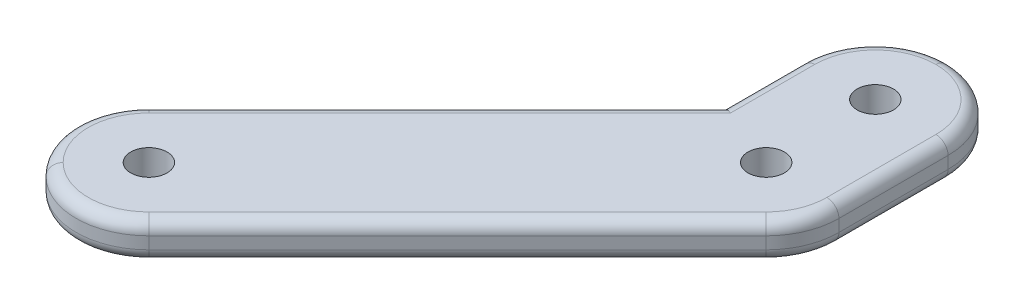
from build123d import *

# Parameters (mm, degrees)
SKETCH1_R           = 3.175
BOSS_EXTRUDE1_DEPTH = 6.35
FILLET2_R           = 12.7
FILLET3_R           = 2.116666667


with BuildPart() as part:
    # Sketch1 → Boss-Extrude1 (new body)
    with BuildSketch(Plane(origin=(0, 0, 0), x_dir=(1, 0, 0), z_dir=(0, 1, 0))):
        with BuildLine():
            Line((12.7, 31.205256121), (-12.7, 31.205256121))
            Line((-12.7, 31.205256121), (-12.7, 4.715768363))
            Line((-12.7, 4.715768363), (-71.842048969, -54.426280605))
            Line((-71.842048969, -54.426280605), (-53.881536726, -72.386792847))
            Line((-53.881536726, -72.386792847), (8.980256121, -9.525))
            ThreePointArc((8.980256121, -9.525), (11.733270063, -5.40482347), (12.7, -0.544743879))
            Line((12.7, -0.544743879), (12.7, 31.205256121))
        make_face()
        with Locations(Location((-53.881536726, -54.426280605, 0), (0, 0, 270))):
            Circle(SKETCH1_R, mode=Mode.SUBTRACT)
        with Locations(Location((0, -0.544743879, 0), (0, 0, 270))):
            Circle(SKETCH1_R, mode=Mode.SUBTRACT)
        with Locations(Location((0, 18.505256121, 0), (0, 0, 270))):
            Circle(SKETCH1_R, mode=Mode.SUBTRACT)
    extrude(amount=BOSS_EXTRUDE1_DEPTH)

    # Fillet2
    fillet2_edges = [part.edges().sort_by_distance(p)[0] for p in [
        (12.7, 3.175, -31.205256121),
        (-12.7, 3.175, -31.205256121),
        (-71.842048969, 3.175, 54.426280605),
        (-53.881536726, 3.175, 72.386792847),
    ]]
    fillet(fillet2_edges, radius=FILLET2_R - 0.0001)  # a hair under: the kernel refuses the full size

    # Fillet3
    fillet3_edges = [part.edges().sort_by_distance(p)[0] for p in [
        (11.733270063, 6.35, 5.40482347),
        (-37.780931779, 0, 20.365163416),
        (-12.7, 0, -11.610562242),
        (12.7, 0, -8.980306121),
        (11.733270063, 0, 5.40482347),
        (12.7, 6.35, -8.980306121),
        (-12.7, 6.35, -11.610562242),
        (-37.780931779, 6.35, 20.365163416),
        (-17.960547597, 0, 36.465803719),
        (-53.881536726, 0, 67.126322027),
        (-66.581578148, 0, 54.426280605),
        (-8.98028541, 0, -27.485541531),
        (8.98028541, 0, -27.485541531),
        (-17.960547597, 6.35, 36.465803719),
        (-53.881536726, 6.35, 67.126322027),
        (-66.581578148, 6.35, 54.426280605),
        (-8.98028541, 6.35, -27.485541531),
        (8.98028541, 6.35, -27.485541531),
    ]]
    fillet(fillet3_edges, radius=FILLET3_R)


solid = part.part
